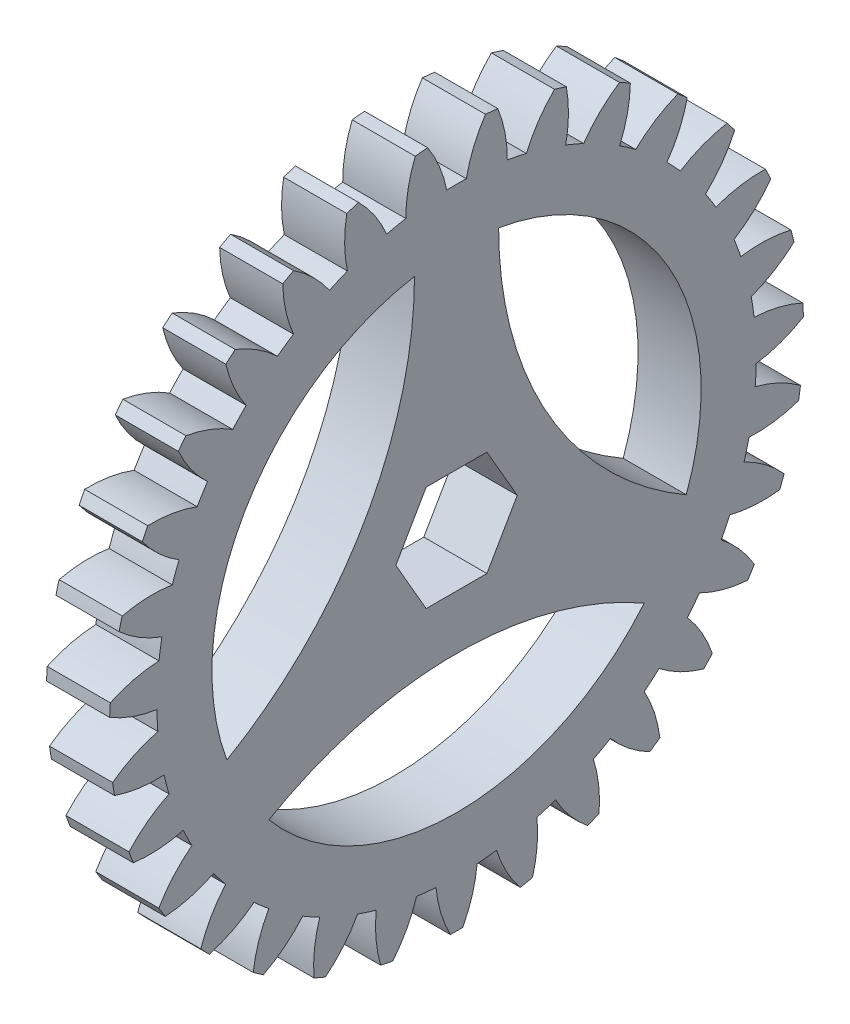
from build123d import *

# Parameters (mm, degrees)
BASPROSKE_W            = 3
BASPROSKE_H            = 16.5
TOOTHCUT_DEPTH         = 24.526580712
TEETHCUTS_COUNT        = 31
TEETHCUTS_ANGLE        = 348.387096774
BORSKE_R               = 2
BORE_DEPTH             = 10.0000508
CUT_EXTRUDE1_START     = -3
CUT_EXTRUDE1_OUTLINE_R = 2
CUT_EXTRUDE1_DEPTH     = 3


# Read off the part's stored shape, not the designer's step: Cut-Extrude1
with BuildPart() as part:
    # BasProSke → Base-Revolve (revolve)
    with BuildSketch(Plane(origin=(0, 0, 0), x_dir=(1, 0, 0), z_dir=(0, 1, 0)), mode=Mode.PRIVATE) as base_revolve_sk:
        with Locations((1.5, 8.25)):
            Rectangle(BASPROSKE_W, BASPROSKE_H)
    revolve(base_revolve_sk.sketch.rotate(Axis((-10, 0, 0), (1, 0, 0)), 180), axis=Axis((-10, 0, 0), (1, 0, 0)))

    # TooCutSke → ToothCut (cut, through all)
    with BuildSketch(Plane(origin=(0, 0, 0), x_dir=(0, 0, -1), z_dir=(1, 0, 0))):
        with BuildLine():
            ThreePointArc((0.464153838, 14.241438207), (0, 14.249), (-0.464153838, 14.241438207))
            ThreePointArc((-0.464153838, 14.241438207), (-0.818831014, 15.399587018), (-1.391915479, 16.466675938))
            ThreePointArc((-1.391915479, 16.466675938), (0, 16.5254), (1.391915479, 16.466675938))
            ThreePointArc((1.391915479, 16.466675938), (0.818831014, 15.399587018), (0.464153838, 14.241438207))
        make_face()
    toothcut = extrude(amount=TOOTHCUT_DEPTH, mode=Mode.SUBTRACT)

    # TeethCuts: ToothCut ×31 about axis
    teethcuts_axis = Axis((-10, 0, 0), (1, 0, 0))
    for i in range(1, TEETHCUTS_COUNT):
        add(toothcut.rotate(teethcuts_axis, i * TEETHCUTS_ANGLE / (TEETHCUTS_COUNT - 1)), mode=Mode.SUBTRACT)

    # BorSke → Bore (cut, symmetric)
    with BuildSketch(Plane(origin=(0, 0, 0), x_dir=(0, 0, -1), z_dir=(1, 0, 0))):
        with Locations(Location((0, 0, 0), (0, 0, 180))):
            Circle(BORSKE_R)
    extrude(amount=BORE_DEPTH, both=True, mode=Mode.SUBTRACT)

    # Cut-Extrude1 outline → Cut-Extrude1 (cut)
    # profile 1 of 4: a face of its own
    with BuildSketch(Plane(origin=(3, 0, 0), x_dir=(0, 0, -1), z_dir=(1, 0, 0)).offset(CUT_EXTRUDE1_START)):
        with BuildLine():
            ThreePointArc((-10.921430027, -3.996089489), (-4.390489971, 2.534850567), (-2, 11.456280594))
            ThreePointArc((-2, 11.456280594), (-10.071483197, 5.814773535), (-10.921430027, -3.996089489))
        make_face()
    # profile 2 of 4: a face of its own
    with BuildSketch(Plane(origin=(3, 0, 0), x_dir=(0, 0, -1), z_dir=(1, 0, 0)).offset(CUT_EXTRUDE1_START)):
        with BuildLine():
            ThreePointArc((2, 11.456280594), (4.390489971, 2.534850567), (10.921430027, -3.996089489))
            ThreePointArc((10.921430027, -3.996089489), (10.071483197, 5.814773535), (2, 11.456280594))
        make_face()
    # profile 3 of 4: a face of its own
    with BuildSketch(Plane(origin=(3, 0, 0), x_dir=(0, 0, -1), z_dir=(1, 0, 0)).offset(CUT_EXTRUDE1_START)):
        with BuildLine():
            ThreePointArc((8.921430027, -7.460191105), (0, -5.069701133), (-8.921430027, -7.460191105))
            ThreePointArc((-8.921430027, -7.460191105), (0, -11.62954707), (8.921430027, -7.460191105))
        make_face()
    # profile 4 of 4: a face of its own
    with BuildSketch(Plane(origin=(3, 0, 0), x_dir=(0, 0, -1), z_dir=(1, 0, 0)).offset(CUT_EXTRUDE1_START)):
        Polygon((-1.443375673, -2.5), (1.443375673, -2.5), (2.886751346, 0), (1.443375673, 2.5), (-1.443375673, 2.5), (-2.886751346, 0), align=None)
        Circle(CUT_EXTRUDE1_OUTLINE_R, mode=Mode.SUBTRACT)
    extrude(amount=CUT_EXTRUDE1_DEPTH, mode=Mode.SUBTRACT)


solid = part.part
